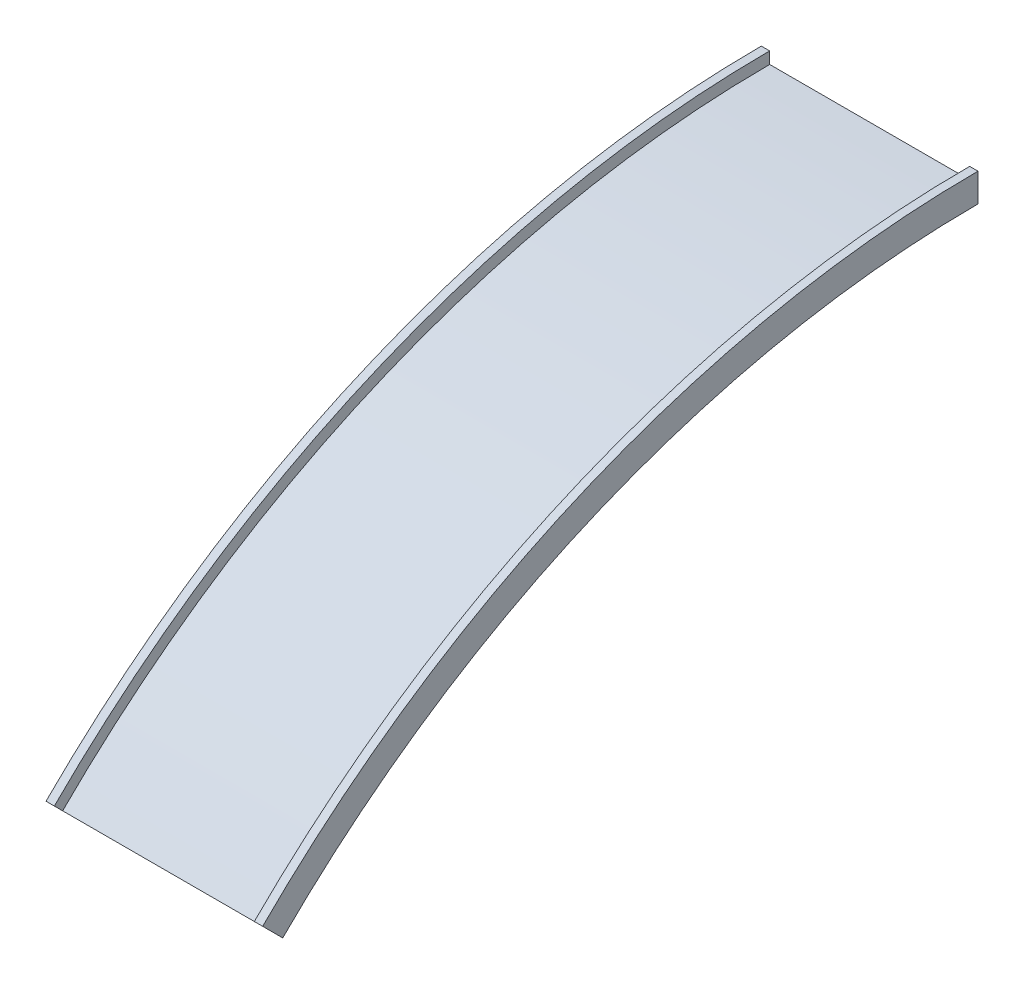
from build123d import *

# Parameters (mm, degrees)
REVOLVE2_ANGLE = 45


with BuildPart() as part:
    # Sketch1 → Revolve2 (revolve)
    with BuildSketch(Plane.XY):
        Polygon((0, 0), (25, 0), (25, -35.236081748), (625, -35.236081748), (625, 0), (650, 0), (650, -85.236081748), (0, -85.236081748), align=None)
    revolve(axis=Axis((0, -3035.236081748, 0), (1, 0, 0)), revolution_arc=REVOLVE2_ANGLE)


solid = part.part
